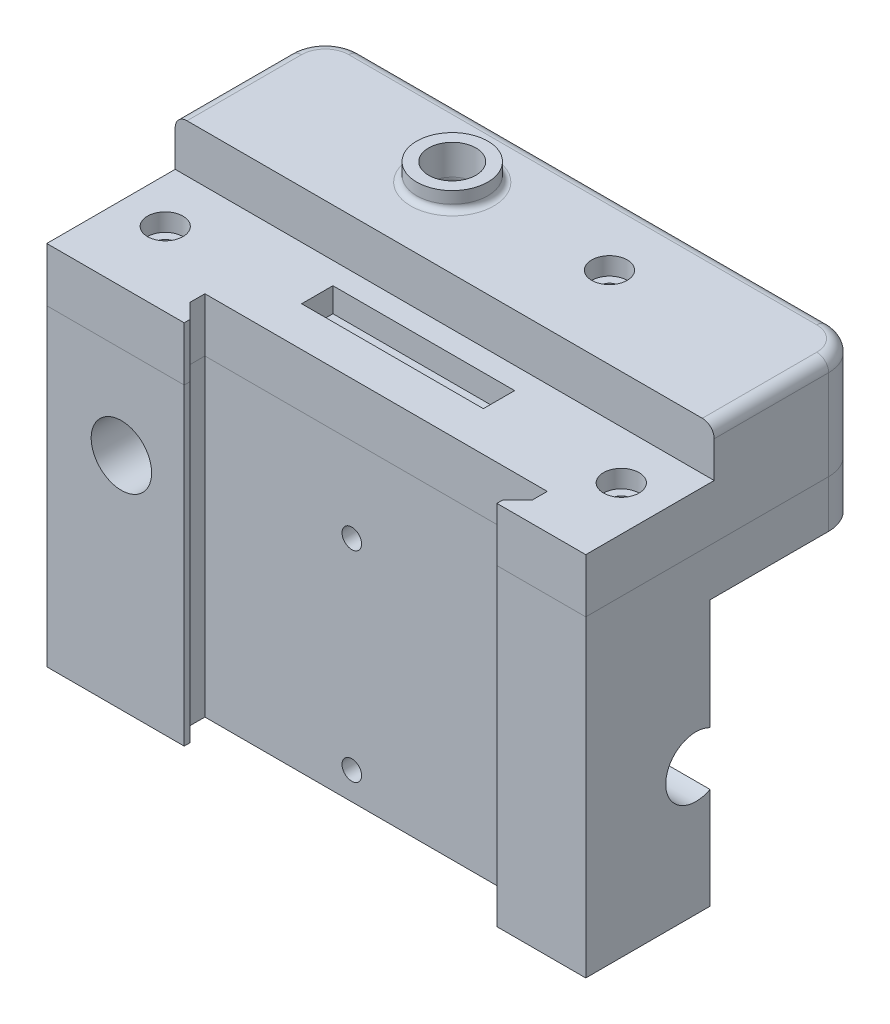
from build123d import *

# Parameters (mm, degrees)
BOSS_EXTRUDE1_DEPTH     = 3
BOSS_EXTRUDE2_START     = 3
BOSS_EXTRUDE2_DEPTH     = 3
BOSS_EXTRUDE3_DEPTH     = 5
BOSS_EXTRUDE5_START     = 5
SKETCH4_4_R             = 1.55
SKETCH4_4_W             = 30.680061
SKETCH4_4_H             = 5.28001
BOSS_EXTRUDE5_DEPTH     = 4.1
BOSS_EXTRUDE9_START     = 5
SKETCH4_8_W             = 3
SKETCH4_8_H             = 3
SKETCH4_8_W_2           = 85
BOSS_EXTRUDE9_DEPTH     = 8.1
BOSS_EXTRUDE10_START    = 13.1
SKETCH4_9_R             = 6
SKETCH4_9_R_2           = 1.55
SKETCH4_9_R_3           = 4
SKETCH4_9_W             = 3
SKETCH4_9_H             = 3
SKETCH4_9_W_2           = 85
BOSS_EXTRUDE10_DEPTH    = 4.1
BOSS_EXTRUDE11_START    = 17.2
SKETCH4_10_R            = 6
SKETCH4_10_R_2          = 4
BOSS_EXTRUDE11_DEPTH    = 3
SKETCH6_R               = 3
SKETCH6_R_2             = 1.55
CUT_EXTRUDE1_DEPTH      = 3
CUT_EXTRUDE2_START      = -8.1
SKETCH6_3_R             = 3
CUT_EXTRUDE2_DEPTH      = 3
BOSS_EXTRUDE13_START    = 46.8
BOSS_EXTRUDE13_DEPTH    = 46.8
FILLET1_R               = 1
FILLET2_R               = 2
FILLET3_R               = 2
BOSS_EXTRUDE14_DEPTH    = 9.1
BOSS_EXTRUDE15_START    = -9.1
BOSS_EXTRUDE15_DEPTH    = 52.8
CUT_EXTRUDE9_DEPTH      = 76.528074301
CUT_EXTRUDE9_DEPTH_BACK = 76.528074301
SKETCH12_R              = 5.1
SKETCH12_3_R            = 9.6
CUT_EXTRUDE10_DEPTH     = 14.6
SKETCH13_W              = 26.025
SKETCH13_H              = 37.392844256
CUT_EXTRUDE11_DEPTH     = 110.156951256
CUT_EXTRUDE12_START     = -26.025
CUT_EXTRUDE12_OUTLINE_W = 65.9
CUT_EXTRUDE12_OUTLINE_H = 9.975
CUT_EXTRUDE12_DEPTH     = 26.025
SKETCH16_R              = 1.6
CUT_EXTRUDE13_DEPTH     = 2.5
SKETCH16_3_R            = 1.6
CUT_EXTRUDE14_DEPTH     = 5
BOSS_EXTRUDE16_DEPTH    = 5
CUT_EXTRUDE15_DEPTH     = 5
SKETCH18_R              = 1.65
CUT_EXTRUDE16_DEPTH     = 2.5
SKETCH18_3_R            = 1.65
CUT_EXTRUDE17_DEPTH     = 104.012332418
CUT_EXTRUDE3_DEPTH      = 14.6
CUT_EXTRUDE3_DEPTH_BACK = 14.6
CUT_EXTRUDE3_START      = 3
SKETCH10_R              = 9.6
SKETCH10_R_2            = 5.1
CUT_EXTRUDE8_DEPTH      = 104.133360267
CUT_EXTRUDE8_DEPTH_BACK = 104.133360267
SKETCH10_7_R            = 5.1


# Read off the part's stored shape, not the designer's step: Cut-Extrude12
with BuildPart() as part:
    # Sketch1 → Boss-Extrude1 (new body)
    with BuildSketch(Plane(origin=(0, 0, 0), x_dir=(1, 0, 0), z_dir=(0, 1, 0))):
        with BuildLine():
            Line((82, 38), (3, 38))
            ThreePointArc((3, 38), (-1.242640687, 36.242640687), (-3, 32))
            Line((-3, 32), (-3, -3))
            Line((-3, -3), (88, -3))
            Line((88, -3), (88, 32))
            ThreePointArc((88, 32), (86.242640687, 36.242640687), (82, 38))
        make_face()
    extrude(amount=BOSS_EXTRUDE1_DEPTH)

    # Sketch1<3> → Boss-Extrude2 (add)
    # profile 1 of 3: a face of its own
    with BuildSketch(Plane(origin=(0, 0, 0), x_dir=(1, 0, 0), z_dir=(0, 1, 0)).offset(BOSS_EXTRUDE2_START)):
        with BuildLine():
            ThreePointArc((88, 32), (86.242640687, 36.242640687), (82, 38))
            Line((82, 38), (3, 38))
            ThreePointArc((3, 38), (-1.242640687, 36.242640687), (-3, 32))
            Line((-3, 32), (-3, 3))
            ThreePointArc((-3, 3), (-1.242640687, -1.242640687), (3, -3))
            Line((3, -3), (82, -3))
            ThreePointArc((82, -3), (86.242640687, -1.242640687), (88, 3))
            Line((88, 3), (88, 32))
        make_face()
        with BuildLine():
            ThreePointArc((0, 32), (0.878679656, 34.121320344), (3, 35))
            Line((3, 35), (82, 35))
            ThreePointArc((82, 35), (84.121320344, 34.121320344), (85, 32))
            Line((85, 32), (85, 3))
            ThreePointArc((85, 3), (84.121320344, 0.878679656), (82, 0))
            Line((82, 0), (3, 0))
            ThreePointArc((3, 0), (0.878679656, 0.878679656), (0, 3))
            Line((0, 3), (0, 32))
        make_face(mode=Mode.SUBTRACT)
    # profile 2 of 3: a face of its own
    with BuildSketch(Plane(origin=(0, 0, 0), x_dir=(1, 0, 0), z_dir=(0, 1, 0)).offset(BOSS_EXTRUDE2_START)):
        with BuildLine():
            Line((88, -3), (88, 3))
            ThreePointArc((88, 3), (86.242640687, -1.242640687), (82, -3))
            Line((82, -3), (88, -3))
        make_face()
    # profile 3 of 3: a face of its own
    with BuildSketch(Plane(origin=(0, 0, 0), x_dir=(1, 0, 0), z_dir=(0, 1, 0)).offset(BOSS_EXTRUDE2_START)):
        with BuildLine():
            ThreePointArc((3, -3), (-1.242640687, -1.242640687), (-3, 3))
            Line((-3, 3), (-3, -3))
            Line((-3, -3), (3, -3))
        make_face()
    extrude(amount=BOSS_EXTRUDE2_DEPTH)

    # Sketch9 → Boss-Extrude13 (add)
    with BuildSketch(Plane.XZ.offset(BOSS_EXTRUDE13_START)):
        with BuildLine():
            Line((3, -38), (82, -38))
            ThreePointArc((82, -38), (86.242640687, -36.242640687), (88, -32))
            Line((88, -32), (88, 3))
            Line((88, 3), (-3, 3))
            Line((-3, 3), (-3, -32))
            ThreePointArc((-3, -32), (-1.242640687, -36.242640687), (3, -38))
        make_face()
    extrude(amount=-BOSS_EXTRUDE13_DEPTH)

    # Sketch11<5> → Boss-Extrude15 (add)
    with BuildSketch(Plane(origin=(0, 15.1, 0), x_dir=(1, 0, 0), z_dir=(0, 1, 0)).offset(BOSS_EXTRUDE15_START)):
        Polygon((88, -9), (88, -3), (75.5, -3), (75.5, -5.5), (73, -8), (73, -9), align=None)
        Polygon((17.7, -5.5), (17.7, -3), (-3, -3), (-3, -9), (20.2, -9), (20.2, -8), align=None)
    extrude(amount=-BOSS_EXTRUDE15_DEPTH)

    # Sketch12 → Cut-Extrude9 (cut, two sides: drawn at the far end of the back side and taken through both)
    with BuildSketch(Plane(origin=(42.5, 0, 0), x_dir=(0, 0, -1), z_dir=(1, 0, 0)).offset(-CUT_EXTRUDE9_DEPTH_BACK)):
        with Locations((9.6, -25.2)):
            Circle(SKETCH12_R)
    extrude(amount=CUT_EXTRUDE9_DEPTH + CUT_EXTRUDE9_DEPTH_BACK, mode=Mode.SUBTRACT)

    # Sketch12<3> → Cut-Extrude10 (cut, symmetric)
    with BuildSketch(Plane(origin=(42.5, 0, 0), x_dir=(0, 0, -1), z_dir=(1, 0, 0))):
        with Locations((9.6, -25.2)):
            Circle(SKETCH12_3_R)
    extrude(amount=CUT_EXTRUDE10_DEPTH, both=True, mode=Mode.SUBTRACT)

    # Sketch13 → Cut-Extrude11 (cut, through all)
    with BuildSketch(Plane(origin=(88, 0, 0), x_dir=(0, 0, -1), z_dir=(1, 0, 0))):
        with Locations((24.9875, -30.671422128)):
            Rectangle(SKETCH13_W, SKETCH13_H)
    extrude(amount=-CUT_EXTRUDE11_DEPTH, mode=Mode.SUBTRACT)

    # Cut-Extrude12 outline → Cut-Extrude12 (cut)
    with BuildSketch(Plane(origin=(0, 0, -38), x_dir=(-1, 0, 0), z_dir=(0, 0, -1)).offset(CUT_EXTRUDE12_START)):
        with Locations((-55.05, -6.9875)):
            Rectangle(CUT_EXTRUDE12_OUTLINE_W, CUT_EXTRUDE12_OUTLINE_H)
    extrude(amount=CUT_EXTRUDE12_DEPTH, mode=Mode.SUBTRACT)

    # Sketch16 → Cut-Extrude13 (cut)
    # profile 1 of 4: a face of its own
    with BuildSketch(Plane(origin=(0, 3, 0), x_dir=(1, 0, 0), z_dir=(0, 1, 0))):
        Polygon((52.8, 31.116580754), (52.8, 27.883419246), (55.6, 26.266838493), (58.4, 27.883419246), (58.4, 31.116580754), (55.6, 32.733161507), align=None)
        with Locations((55.6, 29.5)):
            Circle(SKETCH16_R, mode=Mode.SUBTRACT)
    # profile 2 of 4: a face of its own
    with BuildSketch(Plane(origin=(0, 3, 0), x_dir=(1, 0, 0), z_dir=(0, 1, 0))):
        with Locations((55.6, 29.5)):
            Circle(SKETCH16_R)
    # profile 3 of 4: a face of its own
    with BuildSketch(Plane(origin=(0, 3, 0), x_dir=(1, 0, 0), z_dir=(0, 1, 0))):
        Polygon((34.8, 31.116580754), (34.8, 27.883419246), (37.6, 26.266838493), (40.4, 27.883419246), (40.4, 31.116580754), (37.6, 32.733161507), align=None)
        with Locations((37.6, 29.5)):
            Circle(SKETCH16_R, mode=Mode.SUBTRACT)
    # profile 4 of 4: a face of its own
    with BuildSketch(Plane(origin=(0, 3, 0), x_dir=(1, 0, 0), z_dir=(0, 1, 0))):
        with Locations((37.6, 29.5)):
            Circle(SKETCH16_R)
    extrude(amount=-CUT_EXTRUDE13_DEPTH, mode=Mode.SUBTRACT)

    # Sketch16<3> → Cut-Extrude14 (cut)
    with BuildSketch(Plane(origin=(0, 3, 0), x_dir=(1, 0, 0), z_dir=(0, 1, 0))):
        with Locations(Location((37.6, 29.5, 0), (0, 0, 270))):
            Circle(SKETCH16_3_R)
        with Locations(Location((55.6, 29.5, 0), (0, 0, 270))):
            Circle(SKETCH16_3_R)
    extrude(amount=-CUT_EXTRUDE14_DEPTH, mode=Mode.SUBTRACT)

    # Sketch17<3> → Cut-Extrude15 (cut, symmetric)
    with BuildSketch(Plane(origin=(42.5, 0, 0), x_dir=(0, 0, -1), z_dir=(1, 0, 0))):
        with BuildLine():
            Line((8.975, -34.679418495), (8.975, -46.8))
            Line((8.975, -46.8), (11.975, -46.8))
            Line((11.975, -46.8), (11.975, -37.472301129))
            ThreePointArc((11.975, -37.472301129), (22.1, -25.2), (11.975, -12.927698871))
            Line((11.975, -12.927698871), (11.975, -3.6))
            Line((11.975, -3.6), (8.975, -3.6))
            Line((8.975, -3.6), (8.975, -15.720581505))
            ThreePointArc((8.975, -15.720581505), (19.1, -25.2), (8.975, -34.679418495))
        make_face()
    extrude(amount=CUT_EXTRUDE15_DEPTH, both=True, mode=Mode.SUBTRACT)


with BuildPart() as body_2:
    # Sketch4 → Boss-Extrude3 (new body)
    with BuildSketch(Plane(origin=(0, 6, 0), x_dir=(1, 0, 0), z_dir=(0, 1, 0))):
        with BuildLine():
            ThreePointArc((88, 32), (86.242640687, 36.242640687), (82, 38))
            Line((82, 38), (3, 38))
            ThreePointArc((3, 38), (-1.242640687, 36.242640687), (-3, 32))
            Line((-3, 32), (-3, -3))
            Line((-3, -3), (88, -3))
            Line((88, -3), (88, 32))
        make_face()
        with BuildLine():
            ThreePointArc((0, 32), (0.878679656, 34.121320344), (3, 35))
            Line((3, 35), (82, 35))
            ThreePointArc((82, 35), (84.121320344, 34.121320344), (85, 32))
            Line((85, 32), (85, 3))
            ThreePointArc((85, 3), (84.121320344, 0.878679656), (82, 0))
            Line((82, 0), (3, 0))
            ThreePointArc((3, 0), (0.878679656, 0.878679656), (0, 3))
            Line((0, 3), (0, 32))
        make_face(mode=Mode.SUBTRACT)
    extrude(amount=BOSS_EXTRUDE3_DEPTH)

    # Sketch4<4> → Boss-Extrude5 (add)
    with BuildSketch(Plane(origin=(0, 6, 0), x_dir=(1, 0, 0), z_dir=(0, 1, 0)).offset(BOSS_EXTRUDE5_START)):
        with BuildLine():
            ThreePointArc((88, 32), (86.242640687, 36.242640687), (82, 38))
            Line((82, 38), (3, 38))
            ThreePointArc((3, 38), (-1.242640687, 36.242640687), (-3, 32))
            Line((-3, 32), (-3, -3))
            Line((-3, -3), (88, -3))
            Line((88, -3), (88, 32))
        make_face()
        with BuildLine():
            ThreePointArc((0, 32), (0.878679656, 34.121320344), (3, 35))
            Line((3, 35), (82, 35))
            ThreePointArc((82, 35), (84.121320344, 34.121320344), (85, 32))
            Line((85, 32), (85, 12.680026))
            Line((85, 12.680026), (0, 12.680026))
            Line((0, 12.680026), (0, 32))
        make_face(mode=Mode.SUBTRACT)
        with Locations(Location((80.500161, 4.500009, 0), (0, 0, 270))):
            Circle(SKETCH4_4_R, mode=Mode.SUBTRACT)
        with Locations((42.6700855, 6.340013)):
            Rectangle(SKETCH4_4_W, SKETCH4_4_H, mode=Mode.SUBTRACT)
        with Locations(Location((4.5, 3.5, 0), (0, 0, 270))):
            Circle(SKETCH4_4_R, mode=Mode.SUBTRACT)
    extrude(amount=BOSS_EXTRUDE5_DEPTH)

    # Sketch4<8> → Boss-Extrude9 (add)
    with BuildSketch(Plane(origin=(0, 6, 0), x_dir=(1, 0, 0), z_dir=(0, 1, 0)).offset(BOSS_EXTRUDE9_START)):
        with BuildLine():
            ThreePointArc((88, 32), (86.242640687, 36.242640687), (82, 38))
            Line((82, 38), (3, 38))
            ThreePointArc((3, 38), (-1.242640687, 36.242640687), (-3, 32))
            Line((-3, 32), (-3, 15.680026))
            Line((-3, 15.680026), (0, 15.680026))
            Line((0, 15.680026), (0, 32))
            ThreePointArc((0, 32), (0.878679656, 34.121320344), (3, 35))
            Line((3, 35), (82, 35))
            ThreePointArc((82, 35), (84.121320344, 34.121320344), (85, 32))
            Line((85, 32), (85, 15.680026))
            Line((85, 15.680026), (88, 15.680026))
            Line((88, 15.680026), (88, 32))
        make_face()
        with Locations((-1.5, 14.180026)):
            Rectangle(SKETCH4_8_W, SKETCH4_8_H)
        with Locations((42.5, 14.180026)):
            Rectangle(SKETCH4_8_W_2, SKETCH4_8_H)
        with Locations((86.5, 14.180026)):
            Rectangle(SKETCH4_8_W, SKETCH4_8_H)
    extrude(amount=BOSS_EXTRUDE9_DEPTH)

    # Sketch4<9> → Boss-Extrude10 (add)
    # profile 1 of 6: a face of its own
    with BuildSketch(Plane(origin=(0, 6, 0), x_dir=(1, 0, 0), z_dir=(0, 1, 0)).offset(BOSS_EXTRUDE10_START)):
        with BuildLine():
            Line((0, 15.680026), (85, 15.680026))
            Line((85, 15.680026), (85, 32))
            ThreePointArc((85, 32), (84.121320344, 34.121320344), (82, 35))
            Line((82, 35), (3, 35))
            ThreePointArc((3, 35), (0.878679656, 34.121320344), (0, 32))
            Line((0, 32), (0, 15.680026))
        make_face()
        with Locations((30.360061, 26.100052)):
            Circle(SKETCH4_9_R, mode=Mode.SUBTRACT)
        with Locations(Location((56.500113, 26.500053, 0), (0, 0, 270))):
            Circle(SKETCH4_9_R_2, mode=Mode.SUBTRACT)
    # profile 2 of 6: a face of its own
    with BuildSketch(Plane(origin=(0, 6, 0), x_dir=(1, 0, 0), z_dir=(0, 1, 0)).offset(BOSS_EXTRUDE10_START)):
        with BuildLine():
            ThreePointArc((88, 32), (86.242640687, 36.242640687), (82, 38))
            Line((82, 38), (3, 38))
            ThreePointArc((3, 38), (-1.242640687, 36.242640687), (-3, 32))
            Line((-3, 32), (-3, 15.680026))
            Line((-3, 15.680026), (0, 15.680026))
            Line((0, 15.680026), (0, 32))
            ThreePointArc((0, 32), (0.878679656, 34.121320344), (3, 35))
            Line((3, 35), (82, 35))
            ThreePointArc((82, 35), (84.121320344, 34.121320344), (85, 32))
            Line((85, 32), (85, 15.680026))
            Line((85, 15.680026), (88, 15.680026))
            Line((88, 15.680026), (88, 32))
        make_face()
    # profile 3 of 6: a face of its own
    with BuildSketch(Plane(origin=(0, 6, 0), x_dir=(1, 0, 0), z_dir=(0, 1, 0)).offset(BOSS_EXTRUDE10_START)):
        with Locations((30.360061, 26.100052)):
            Circle(SKETCH4_9_R)
        with Locations(Location((30.360061, 26.100052, 0), (0, 0, 270))):
            Circle(SKETCH4_9_R_3, mode=Mode.SUBTRACT)
    # profile 4 of 6: a face of its own
    with BuildSketch(Plane(origin=(0, 6, 0), x_dir=(1, 0, 0), z_dir=(0, 1, 0)).offset(BOSS_EXTRUDE10_START)):
        with Locations((86.5, 14.180026)):
            Rectangle(SKETCH4_9_W, SKETCH4_9_H)
    # profile 5 of 6: a face of its own
    with BuildSketch(Plane(origin=(0, 6, 0), x_dir=(1, 0, 0), z_dir=(0, 1, 0)).offset(BOSS_EXTRUDE10_START)):
        with Locations((42.5, 14.180026)):
            Rectangle(SKETCH4_9_W_2, SKETCH4_9_H)
    # profile 6 of 6: a face of its own
    with BuildSketch(Plane(origin=(0, 6, 0), x_dir=(1, 0, 0), z_dir=(0, 1, 0)).offset(BOSS_EXTRUDE10_START)):
        with Locations((-1.5, 14.180026)):
            Rectangle(SKETCH4_9_W, SKETCH4_9_H)
    extrude(amount=BOSS_EXTRUDE10_DEPTH)

    # Sketch4<10> → Boss-Extrude11 (add)
    with BuildSketch(Plane(origin=(0, 6, 0), x_dir=(1, 0, 0), z_dir=(0, 1, 0)).offset(BOSS_EXTRUDE11_START)):
        with Locations(Location((30.360061, 26.100052, 0), (0, 0, 270))):
            Circle(SKETCH4_10_R)
        with Locations(Location((30.360061, 26.100052, 0), (0, 0, 270))):
            Circle(SKETCH4_10_R_2, mode=Mode.SUBTRACT)
    extrude(amount=BOSS_EXTRUDE11_DEPTH)

    # Sketch6 → Cut-Extrude1 (cut)
    with BuildSketch(Plane(origin=(0, 23.2, 0), x_dir=(1, 0, 0), z_dir=(0, 1, 0))):
        with Locations(Location((56.500113, 26.500053, 0), (0, 0, 270))):
            Circle(SKETCH6_R)
        with Locations(Location((56.500113, 26.500053, 0), (0, 0, 270))):
            Circle(SKETCH6_R_2, mode=Mode.SUBTRACT)
    extrude(amount=-CUT_EXTRUDE1_DEPTH, mode=Mode.SUBTRACT)

    # Sketch6<3> → Cut-Extrude2 (cut)
    with BuildSketch(Plane(origin=(0, 23.2, 0), x_dir=(1, 0, 0), z_dir=(0, 1, 0)).offset(CUT_EXTRUDE2_START)):
        with Locations(Location((4.5, 3.5, 0), (0, 0, 270))):
            Circle(SKETCH6_3_R)
        with Locations(Location((80.500161, 4.500009, 0), (0, 0, 270))):
            Circle(SKETCH6_3_R)
    extrude(amount=-CUT_EXTRUDE2_DEPTH, mode=Mode.SUBTRACT)

    # Fillet1
    fillet1_edges = [body_2.edges().sort_by_distance(p)[0] for p in [
        (30.360061, 23.2, -32.100052),
    ]]
    fillet(fillet1_edges, radius=FILLET1_R)

    # Fillet2
    fillet2_edges = [body_2.edges().sort_by_distance(p)[0] for p in [
        (0, 15.05, -15.680026),
        (42.5, 19.1, -15.680026),
        (84.121320344, 19.1, -34.121320344),
        (42.5, 19.1, -35),
        (0.878679656, 19.1, -34.121320344),
        (0, 19.1, -23.840013),
        (42.5, 11, -15.680026),
        (85, 15.05, -15.680026),
        (85, 19.1, -23.840013),
        (30.360061, 19.1, -30.100052),
        (84.121320344, 11, -0.878679656),
        (85, 11, -9.340013),
        (42.5, 11, 0),
        (0.878679656, 11, -0.878679656),
        (0, 11, -9.340013),
    ]]
    fillet(fillet2_edges, radius=FILLET2_R)

    # Fillet3
    fillet3_edges = [body_2.edges().sort_by_distance(p)[0] for p in [
        (-1.242640687, 23.2, -36.242640687),
        (86.242640687, 23.2, -36.242640687),
        (-3, 23.2, -22.340013),
        (88, 23.2, -22.340013),
        (42.5, 23.2, -38),
    ]]
    fillet(fillet3_edges, radius=FILLET3_R)

    # Sketch11 → Boss-Extrude14 (add)
    with BuildSketch(Plane(origin=(0, 15.1, 0), x_dir=(1, 0, 0), z_dir=(0, 1, 0))):
        Polygon((88, -9), (88, -3), (75.5, -3), (75.5, -5.5), (73, -8), (73, -9), align=None)
        Polygon((17.7, -5.5), (17.7, -3), (-3, -3), (-3, -9), (20.2, -9), (20.2, -8), align=None)
    extrude(amount=-BOSS_EXTRUDE14_DEPTH)


with BuildPart() as body_3:
    # Sketch17 → Boss-Extrude16 (new, symmetric)
    with BuildSketch(Plane(origin=(42.5, 0, 0), x_dir=(0, 0, -1), z_dir=(1, 0, 0))):
        with BuildLine():
            Line((8.975, -34.679418495), (8.975, -46.8))
            Line((8.975, -46.8), (11.975, -46.8))
            Line((11.975, -46.8), (11.975, -37.472301129))
            ThreePointArc((11.975, -37.472301129), (22.1, -25.2), (11.975, -12.927698871))
            Line((11.975, -12.927698871), (11.975, -3.6))
            Line((11.975, -3.6), (8.975, -3.6))
            Line((8.975, -3.6), (8.975, -15.720581505))
            ThreePointArc((8.975, -15.720581505), (19.1, -25.2), (8.975, -34.679418495))
        make_face()
    extrude(amount=BOSS_EXTRUDE16_DEPTH, both=True)

    # Sketch18 → Cut-Extrude16 (cut)
    # profile 1 of 4: a face of its own
    with BuildSketch(Plane(origin=(0, 0, -11.975), x_dir=(-1, 0, 0), z_dir=(0, 0, -1))):
        Polygon((-44.116580754, -11.063849436), (-40.883419246, -11.063849436), (-39.266838493, -8.263849436), (-40.883419246, -5.463849436), (-44.116580754, -5.463849436), (-45.733161507, -8.263849436), align=None)
        with Locations((-42.5, -8.263849436)):
            Circle(SKETCH18_R, mode=Mode.SUBTRACT)
    # profile 2 of 4: a face of its own
    with BuildSketch(Plane(origin=(0, 0, -11.975), x_dir=(-1, 0, 0), z_dir=(0, 0, -1))):
        with Locations((-42.5, -8.263849436)):
            Circle(SKETCH18_R)
    # profile 3 of 4: a face of its own
    with BuildSketch(Plane(origin=(0, 0, -11.975), x_dir=(-1, 0, 0), z_dir=(0, 0, -1))):
        Polygon((-44.116580754, -44.936150564), (-40.883419246, -44.936150564), (-39.266838493, -42.136150564), (-40.883419246, -39.336150564), (-44.116580754, -39.336150564), (-45.733161507, -42.136150564), align=None)
        with Locations((-42.5, -42.136150564)):
            Circle(SKETCH18_R, mode=Mode.SUBTRACT)
    # profile 4 of 4: a face of its own
    with BuildSketch(Plane(origin=(0, 0, -11.975), x_dir=(-1, 0, 0), z_dir=(0, 0, -1))):
        with Locations((-42.5, -42.136150564)):
            Circle(SKETCH18_R)
    extrude(amount=-CUT_EXTRUDE16_DEPTH, mode=Mode.SUBTRACT)


with BuildPart() as cut_extrude17_tool:
    # Sketch18<3> → Cut-Extrude17 (new, through all)
    with BuildSketch(Plane(origin=(0, 0, -11.975), x_dir=(-1, 0, 0), z_dir=(0, 0, -1))):
        with Locations(Location((-42.5, -42.136150564, 0), (0, 0, 90))):
            Circle(SKETCH18_3_R)
        with Locations(Location((-42.5, -8.263849436, 0), (0, 0, 90))):
            Circle(SKETCH18_3_R)
    extrude(amount=-CUT_EXTRUDE17_DEPTH)


with BuildPart() as part_1:
    add(part.part)

    # Cut-Extrude17: cut by cut_extrude17_tool
    add(cut_extrude17_tool.part, mode=Mode.SUBTRACT)

    # Sketch10 → Cut-Extrude3 (cut, two sides: drawn at the far end of the back side and taken through both)
    with BuildSketch(Plane.XY.offset(-17.5).offset(CUT_EXTRUDE3_START - CUT_EXTRUDE3_DEPTH_BACK)):
        with Locations(Location((9.6, -9.6, 0), (0, 0, 194.32346436))):
            Circle(SKETCH10_R)
        with Locations(Location((9.6, -9.6, 0), (0, 0, 207.754645601))):
            Circle(SKETCH10_R_2, mode=Mode.SUBTRACT)
    extrude(amount=CUT_EXTRUDE3_DEPTH + CUT_EXTRUDE3_DEPTH_BACK, mode=Mode.SUBTRACT)

    # Sketch10<7> → Cut-Extrude8 (cut, two sides: drawn at the far end of the back side and taken through both)
    with BuildSketch(Plane.XY.offset(-17.5).offset(-CUT_EXTRUDE8_DEPTH_BACK)):
        with Locations((9.6, -9.6)):
            Circle(SKETCH10_7_R)
    extrude(amount=CUT_EXTRUDE8_DEPTH + CUT_EXTRUDE8_DEPTH_BACK, mode=Mode.SUBTRACT)


with BuildPart() as body_3_1:
    add(body_3.part)

    # Cut-Extrude17: cut by cut_extrude17_tool
    add(cut_extrude17_tool.part, mode=Mode.SUBTRACT)


solid = Compound([body_2.part, part_1.part, body_3_1.part])
